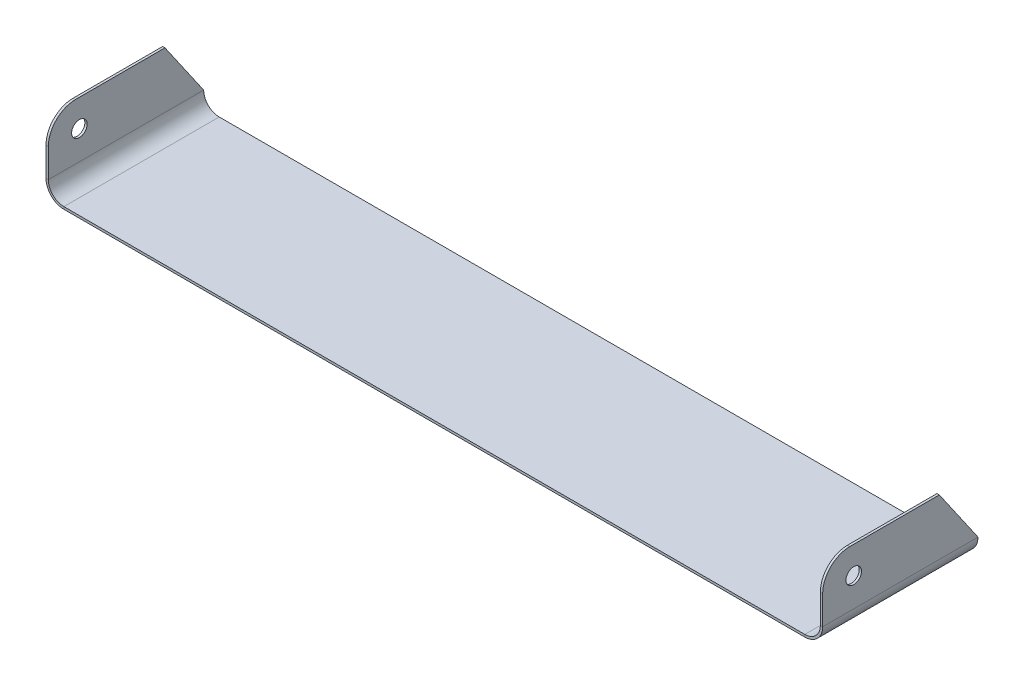
from build123d import *

# Parameters (mm, degrees)
SKETCH1_W                    = 1000
SKETCH1_H                    = 200
BASE_FLANGE1_DEPTH           = 3
EDGE_FLANGE1_STRIP_W         = 52
EDGE_FLANGE1_STRIP_H         = 3
EDGE_FLANGE1_STRIP_CUT_DEPTH = 200
EDGE_FLANGE1_DEPTH           = 200
EDGE_FLANGE1_FLAT_DEPTH      = 3
EDGE_FLANGE2_STRIP_W         = 52
EDGE_FLANGE2_STRIP_H         = 3
EDGE_FLANGE2_STRIP_CUT_DEPTH = 200
EDGE_FLANGE2_DEPTH           = 200
EDGE_FLANGE2_FLAT_DEPTH      = 3
SKETCH13_R                   = 10
CUT_EXTRUDE1_DEPTH           = 1010.189774027


# Sheet-metal steps are written as plain solids
with BuildPart() as part:
    # Sketch1 → Base-Flange1 (new body)
    with BuildSketch(Plane(origin=(0, 0, 0), x_dir=(1, 0, 0), z_dir=(0, 1, 0))):
        Rectangle(SKETCH1_W, SKETCH1_H)
    extrude(amount=-BASE_FLANGE1_DEPTH)

    # Edge-Flange1 strip (across the edge) → Edge-Flange1 strip cut (cut)
    with BuildSketch(Plane(origin=(-500, 0, -100), x_dir=(1, 0, 0), z_dir=(0, 0, 1))):
        with Locations((-3, -1.5)):
            Rectangle(EDGE_FLANGE1_STRIP_W, EDGE_FLANGE1_STRIP_H)
    extrude(amount=EDGE_FLANGE1_STRIP_CUT_DEPTH, mode=Mode.SUBTRACT)

    # Edge-Flange1 bend section (across the edge) → Edge-Flange1 (add)
    with BuildSketch(Plane(origin=(-500, 0, -100), x_dir=(1, 0, 0), z_dir=(0, 0, 1))):
        with BuildLine():
            Line((0, 20), (3, 20))
            ThreePointArc((3, 20), (8.857864376, 5.857864376), (23, 0))
            Line((23, 0), (23, -3))
            ThreePointArc((23, -3), (6.736544033, 3.736544033), (0, 20))
        make_face()
    extrude(amount=EDGE_FLANGE1_DEPTH)

    # Edge-Flange1 profile (on flange) → Edge-Flange1 flat (add)
    with BuildSketch(Plane.ZY.offset(500)):
        with BuildLine():
            Line((-100, 92), (-100, 20))
            Line((-100, 20), (100, 20))
            Line((100, 20), (100, 57))
            ThreePointArc((100, 57), (89.748737342, 81.748737342), (65, 92))
            Line((65, 92), (-100, 92))
        make_face()
    extrude(amount=-EDGE_FLANGE1_FLAT_DEPTH)

    # Edge-Flange2 strip (across the edge) → Edge-Flange2 strip cut (cut)
    with BuildSketch(Plane(origin=(500, 0, 100), x_dir=(-1, 0, 0), z_dir=(0, 0, -1))):
        with Locations((-3, -1.5)):
            Rectangle(EDGE_FLANGE2_STRIP_W, EDGE_FLANGE2_STRIP_H)
    extrude(amount=EDGE_FLANGE2_STRIP_CUT_DEPTH, mode=Mode.SUBTRACT)

    # Edge-Flange2 bend section (across the edge) → Edge-Flange2 (add)
    with BuildSketch(Plane(origin=(500, 0, 100), x_dir=(-1, 0, 0), z_dir=(0, 0, -1))):
        with BuildLine():
            Line((0, 20), (3, 20))
            ThreePointArc((3, 20), (8.857864376, 5.857864376), (23, 0))
            Line((23, 0), (23, -3))
            ThreePointArc((23, -3), (6.736544033, 3.736544033), (0, 20))
        make_face()
    extrude(amount=EDGE_FLANGE2_DEPTH)

    # Edge-Flange2 profile (on flange) → Edge-Flange2 flat (add)
    with BuildSketch(Plane(origin=(500, 0, 0), x_dir=(0, 0, -1), z_dir=(1, 0, 0))):
        with BuildLine():
            Line((100, 92), (-65, 92))
            ThreePointArc((-65, 92), (-89.748737342, 81.748737342), (-100, 57))
            Line((-100, 57), (-100, 20))
            Line((-100, 20), (100, 20))
            Line((100, 20), (100, 92))
        make_face()
    extrude(amount=-EDGE_FLANGE2_FLAT_DEPTH)

    # Sketch13 → Cut-Extrude1 (cut, through all)
    with BuildSketch(Plane.ZY.offset(500)):
        with Locations(Location((60, 57, 0), (0, 0, 270))):
            Circle(SKETCH13_R)
        Polygon((-100, 20), (-50, 92.245135124), (-100, 92), align=None)
    extrude(amount=-CUT_EXTRUDE1_DEPTH, mode=Mode.SUBTRACT)


solid = part.part
